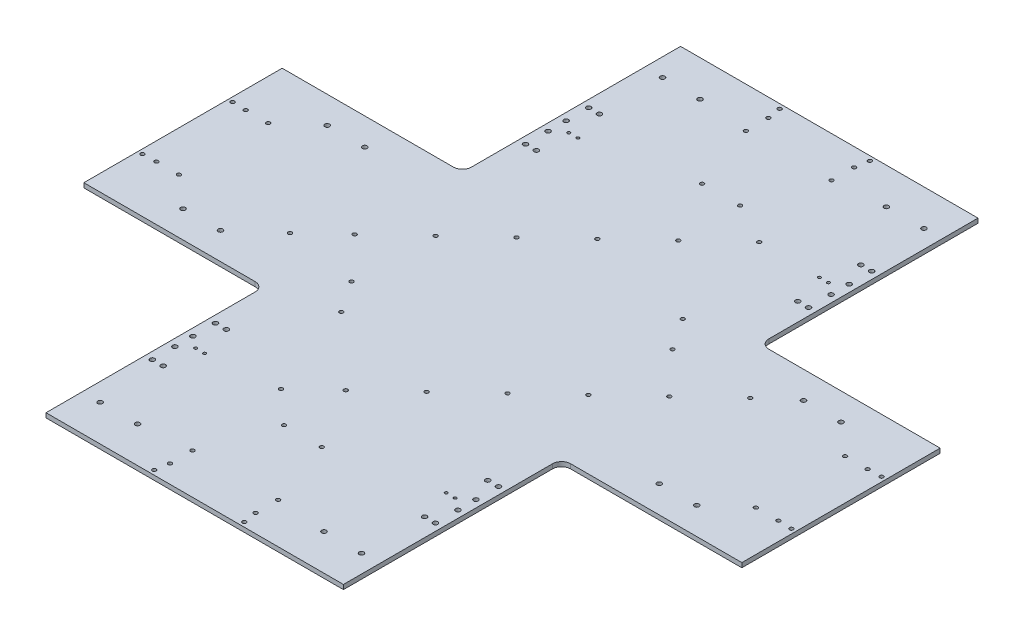
from build123d import *

# Parameters (mm, degrees)
BOSS_EXTRUDE1_DEPTH = 5
SKETCH2_R           = 2.125
CUT_EXTRUDE1_DEPTH  = 3
SKETCH4_R           = 2.6
SKETCH4_R_2         = 1.6
CUT_EXTRUDE3_DEPTH  = 10
SKETCH5_R           = 2.125
CUT_EXTRUDE4_DEPTH  = 10
FILLET1_R           = 10
SKETCH6_R           = 2.6
CUT_EXTRUDE5_DEPTH  = 10
SKETCH7_R           = 2.125
CUT_EXTRUDE6_DEPTH  = 10
SKETCH9_R           = 2.1
CUT_EXTRUDE7_DEPTH  = 10


with BuildPart() as part:
    # Sketch1 → Boss-Extrude1 (new body)
    with BuildSketch(Plane(origin=(0, 0, 0), x_dir=(1, 0, 0), z_dir=(0, 1, 0))):
        Polygon((165, 352), (-165, 352), (-165, 110), (-365, 110), (-365, -110), (-165, -110), (-165, -352), (165, -352), (165, -110), (365, -110), (365, 110), (165, 110), align=None)
    extrude(amount=BOSS_EXTRUDE1_DEPTH)

    # Sketch2 → Cut-Extrude1 (cut)
    with BuildSketch(Plane(origin=(0, 5, 0), x_dir=(1, 0, 0), z_dir=(0, 1, 0))):
        with Locations((345, 49.5)):
            Circle(SKETCH2_R)
        with Locations((320, 49.5)):
            Circle(SKETCH2_R)
        with Locations((320, -49.5)):
            Circle(SKETCH2_R)
        with Locations((345, -49.5)):
            Circle(SKETCH2_R)
        with Locations((-345, -49.5)):
            Circle(SKETCH2_R)
        with Locations((-320, -49.5)):
            Circle(SKETCH2_R)
        with Locations((-320, 49.5)):
            Circle(SKETCH2_R)
        with Locations((-345, 49.5)):
            Circle(SKETCH2_R)
        with Locations((47.5, 332)):
            Circle(SKETCH2_R)
        with Locations((47.5, 307)):
            Circle(SKETCH2_R)
        with Locations((-47.5, 307)):
            Circle(SKETCH2_R)
        with Locations((-47.5, 332)):
            Circle(SKETCH2_R)
        with Locations((-47.5, -332)):
            Circle(SKETCH2_R)
        with Locations((-47.5, -307)):
            Circle(SKETCH2_R)
        with Locations((47.5, -307)):
            Circle(SKETCH2_R)
        with Locations((47.5, -332)):
            Circle(SKETCH2_R)
    extrude(amount=-CUT_EXTRUDE1_DEPTH, mode=Mode.SUBTRACT)

    # Sketch4 → Cut-Extrude3 (cut)
    with BuildSketch(Plane(origin=(0, 5, 0), x_dir=(1, 0, 0), z_dir=(0, 1, 0))):
        with Locations((-157, 172)):
            Circle(SKETCH4_R)
        with Locations((-145, 172)):
            Circle(SKETCH4_R)
        with Locations((-157, 197)):
            Circle(SKETCH4_R)
        with Locations((-157, 217)):
            Circle(SKETCH4_R)
        with Locations((-157, 242)):
            Circle(SKETCH4_R)
        with Locations((-145, 242)):
            Circle(SKETCH4_R)
        with Locations((145, 242)):
            Circle(SKETCH4_R)
        with Locations((157, 242)):
            Circle(SKETCH4_R)
        with Locations((157, 217)):
            Circle(SKETCH4_R)
        with Locations((157, 197)):
            Circle(SKETCH4_R)
        with Locations((145, 172)):
            Circle(SKETCH4_R)
        with Locations((157, 172)):
            Circle(SKETCH4_R)
        with Locations((157, -172)):
            Circle(SKETCH4_R)
        with Locations((145, -172)):
            Circle(SKETCH4_R)
        with Locations((157, -197)):
            Circle(SKETCH4_R)
        with Locations((157, -217)):
            Circle(SKETCH4_R)
        with Locations((157, -242)):
            Circle(SKETCH4_R)
        with Locations((145, -242)):
            Circle(SKETCH4_R)
        with Locations((-145, -242)):
            Circle(SKETCH4_R)
        with Locations((-157, -242)):
            Circle(SKETCH4_R)
        with Locations((-157, -217)):
            Circle(SKETCH4_R)
        with Locations((-157, -197)):
            Circle(SKETCH4_R)
        with Locations((-145, -172)):
            Circle(SKETCH4_R)
        with Locations((-157, -172)):
            Circle(SKETCH4_R)
        with Locations((144, -207)):
            Circle(SKETCH4_R_2)
        with Locations((-144, -207)):
            Circle(SKETCH4_R_2)
        with Locations((144, 207)):
            Circle(SKETCH4_R_2)
        with Locations((-144, 207)):
            Circle(SKETCH4_R_2)
        with Locations((134, -207)):
            Circle(SKETCH4_R_2)
        with Locations((-134, -207)):
            Circle(SKETCH4_R_2)
        with Locations((134, 207)):
            Circle(SKETCH4_R_2)
        with Locations((-134, 207)):
            Circle(SKETCH4_R_2)
    extrude(amount=-CUT_EXTRUDE3_DEPTH, mode=Mode.SUBTRACT)

    # Sketch5 → Cut-Extrude4 (cut)
    with BuildSketch(Plane(origin=(0, 5, 0), x_dir=(1, 0, 0), z_dir=(0, 1, 0))):
        with Locations((-50, 347)):
            Circle(SKETCH5_R)
        with Locations((50, 347)):
            Circle(SKETCH5_R)
        with Locations((50, -347)):
            Circle(SKETCH5_R)
        with Locations((-50, -347)):
            Circle(SKETCH5_R)
        with Locations((-360, 50)):
            Circle(SKETCH5_R)
        with Locations((-360, -50)):
            Circle(SKETCH5_R)
        with Locations((360, -50)):
            Circle(SKETCH5_R)
        with Locations((360, 50)):
            Circle(SKETCH5_R)
    extrude(amount=-CUT_EXTRUDE4_DEPTH, mode=Mode.SUBTRACT)

    # Fillet1
    fillet1_edges = [part.edges().sort_by_distance(p)[0] for p in [
        (-165, 2.5, -110),
        (-165, 2.5, 110),
        (165, 2.5, 110),
        (165, 2.5, -110),
    ]]
    fillet(fillet1_edges, radius=FILLET1_R)

    # Sketch6 → Cut-Extrude5 (cut)
    with BuildSketch(Plane(origin=(0, 5, 0), x_dir=(1, 0, 0), z_dir=(0, 1, 0))):
        with Locations((-145, 312)):
            Circle(SKETCH6_R)
        with Locations((-103.4, 312)):
            Circle(SKETCH6_R)
        with Locations((103.4, 312)):
            Circle(SKETCH6_R)
        with Locations((145, 312)):
            Circle(SKETCH6_R)
        with Locations((145, -312)):
            Circle(SKETCH6_R)
        with Locations((103.4, -312)):
            Circle(SKETCH6_R)
        with Locations((-103.4, -312)):
            Circle(SKETCH6_R)
        with Locations((-145, -312)):
            Circle(SKETCH6_R)
        with Locations((243.4, 80)):
            Circle(SKETCH6_R)
        with Locations((285, 80)):
            Circle(SKETCH6_R)
        with Locations((285, -80)):
            Circle(SKETCH6_R)
        with Locations((243.4, -80)):
            Circle(SKETCH6_R)
        with Locations((-243.4, -80)):
            Circle(SKETCH6_R)
        with Locations((-285, -80)):
            Circle(SKETCH6_R)
        with Locations((-285, 80)):
            Circle(SKETCH6_R)
        with Locations((-243.4, 80)):
            Circle(SKETCH6_R)
    extrude(amount=-CUT_EXTRUDE5_DEPTH, mode=Mode.SUBTRACT)

    # Sketch7 → Cut-Extrude6 (cut)
    with BuildSketch(Plane(origin=(0, 5, 0), x_dir=(1, 0, 0), z_dir=(0, 1, 0))):
        with Locations((-72.423012394, 77.400951388)):
            Circle(SKETCH7_R)
        with Locations((-26.055461327, 120.786435228)):
            Circle(SKETCH7_R)
        with Locations((20.31208974, 164.171919068)):
            Circle(SKETCH7_R)
        with Locations((66.679640807, 207.557402908)):
            Circle(SKETCH7_R)
        with Locations((-118.790563461, 34.015467548)):
            Circle(SKETCH7_R)
        with Locations((-165.158114529, -9.370016292)):
            Circle(SKETCH7_R)
        with Locations((-202.252155383, -44.078403364)):
            Circle(SKETCH7_R)
        with Locations((-57.406130594, -198.88030614)):
            Circle(SKETCH7_R)
        with Locations((-20.31208974, -164.171919068)):
            Circle(SKETCH7_R)
        with Locations((26.055461327, -120.786435228)):
            Circle(SKETCH7_R)
        with Locations((211.525665596, 52.755500132)):
            Circle(SKETCH7_R)
        with Locations((165.158114529, 9.370016292)):
            Circle(SKETCH7_R)
        with Locations((118.790563461, -34.015467548)):
            Circle(SKETCH7_R)
        with Locations((72.423012394, -77.400951388)):
            Circle(SKETCH7_R)
    extrude(amount=-CUT_EXTRUDE6_DEPTH, mode=Mode.SUBTRACT)

    # Sketch9 → Cut-Extrude7 (cut)
    with BuildSketch(Plane(origin=(0, 5, 0), x_dir=(1, 0, 0), z_dir=(0, 1, 0))):
        with Locations((-121.560496485, -56.440276951)):
            Circle(SKETCH9_R)
        with Locations((-98.122996746, -91.292588295)):
            Circle(SKETCH9_R)
        with Locations((98.122996746, 91.292588295)):
            Circle(SKETCH9_R)
        with Locations((121.560496485, 56.440276951)):
            Circle(SKETCH9_R)
        with Locations((21, 232)):
            Circle(SKETCH9_R)
        with Locations((-21, 232)):
            Circle(SKETCH9_R)
        with Locations((-21, -232)):
            Circle(SKETCH9_R)
        with Locations((21, -232)):
            Circle(SKETCH9_R)
    extrude(amount=-CUT_EXTRUDE7_DEPTH, mode=Mode.SUBTRACT)


solid = part.part
